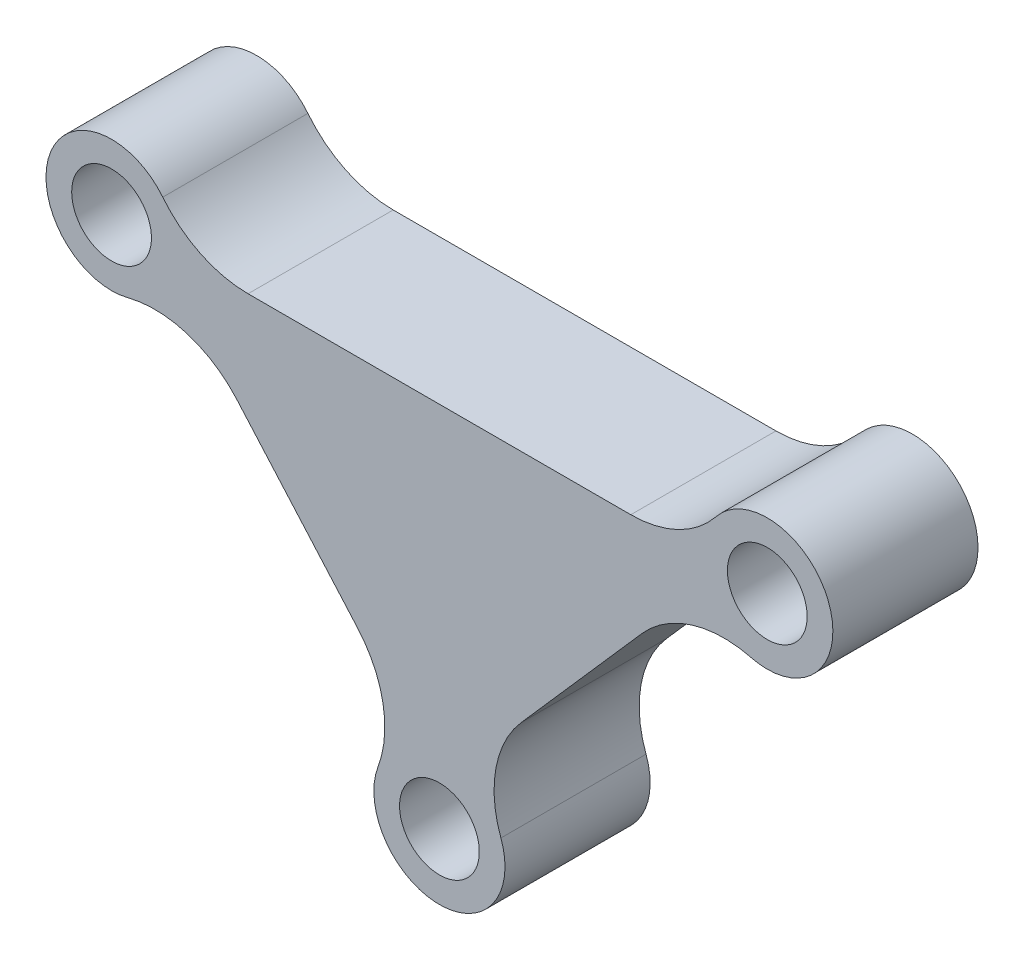
from build123d import *

# Parameters (mm, degrees)
ESQUISSE2_R        = 1.825
BOSS_EXTRU_1_DEPTH = 6.64
CONG_1_R           = 5


with BuildPart() as part:
    # Esquisse2 → Boss.-Extru.1 (new body)
    with BuildSketch(Plane.XY):
        with BuildLine():
            ThreePointArc((-12, 10), (-17.947310062, 10.559788709), (-12.208908932, 8.900086071))
            Line((-12.208908932, 8.900086071), (-0.908352526, -3.965822551))
            ThreePointArc((-0.908352526, -3.965822551), (0, -9.825), (0.908352526, -3.965822551))
            Line((0.908352526, -3.965822551), (12.208908932, 8.900086071))
            ThreePointArc((12.208908932, 8.900086071), (17.947310062, 10.559788709), (12, 10))
            Line((12, 10), (-12, 10))
        make_face()
        with Locations((-15, 10)):
            Circle(ESQUISSE2_R, mode=Mode.SUBTRACT)
        with Locations((15, 10)):
            Circle(ESQUISSE2_R, mode=Mode.SUBTRACT)
        with Locations((0, -6.825)):
            Circle(ESQUISSE2_R, mode=Mode.SUBTRACT)
    extrude(amount=BOSS_EXTRU_1_DEPTH)

    # Congé1
    cong_1_edges = [part.edges().sort_by_distance(p)[0] for p in [
        (-12, 10, 3.32),
        (-12.208908932, 8.900086071, 3.32),
        (-0.908352526, -3.965822551, 3.32),
        (12.208908932, 8.900086071, 3.32),
        (12, 10, 3.32),
        (0.908352526, -3.965822551, 3.32),
    ]]
    fillet(cong_1_edges, radius=CONG_1_R)


solid = part.part
